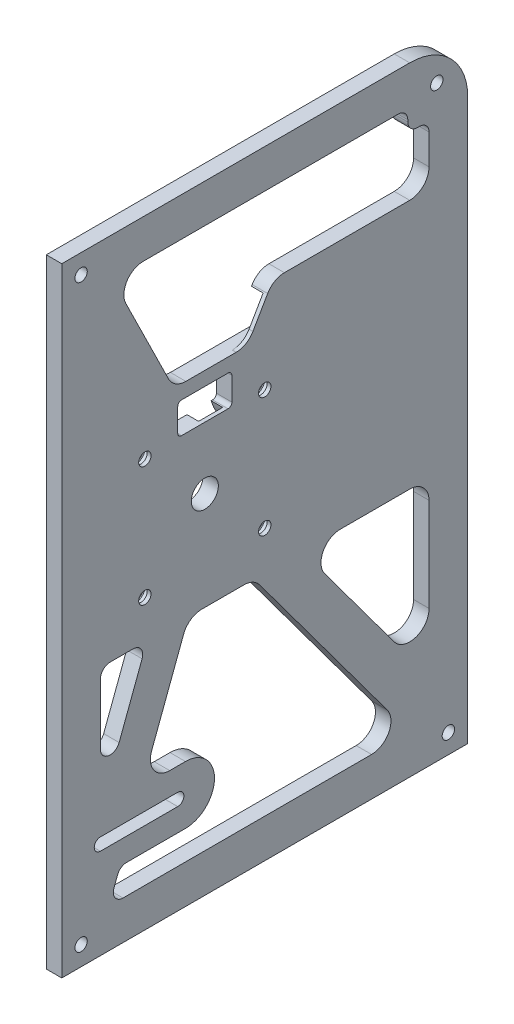
from build123d import *

# Parameters (mm, degrees)
SKETCH2_R               = 1.6
SKETCH2_R_2             = 3.5
SKETCH2_W               = 14
SKETCH2_H               = 8
BOSS_EXTRUDE1_DEPTH     = 4
CHAMFER1_SIZE           = 1.5
FILLET2_R               = 1
CUT_EXTRUDE1_DEPTH      = 3
CUT_EXTRUDE3_DEPTH      = 192.418390062
CUT_EXTRUDE3_DEPTH_BACK = 3
CUT_EXTRUDE4_DEPTH      = 192.418390062
FILLET5_R               = 5
FILLET6_R               = 2.5
SKETCH4_W               = 7.5
SKETCH4_H               = 3
SKETCH4_H_2             = 2.2
BOSS_EXTRUDE2_DEPTH     = 1
CHAMFER2_SIZE           = 1.5
FILLET7_R               = 1.5
SKETCH8_R               = 3.25
CUT_EXTRUDE5_DEPTH      = 3
CHAMFER3_SIZE           = 1


with BuildPart() as part:
    # Sketch2 → Boss-Extrude1 (new body)
    with BuildSketch(Plane(origin=(0, 0, 0), x_dir=(0, 0, -1), z_dir=(1, 0, 0))):
        with BuildLine():
            Line((0, 0), (105, 0))
            Line((105, 0), (105, 145))
            ThreePointArc((105, 145), (100.606601718, 155.606601718), (90, 160))
            Line((90, 160), (0, 160))
            Line((0, 160), (0, 0))
        make_face()
        with Locations((97, 152)):
            Circle(SKETCH2_R, mode=Mode.SUBTRACT)
        with Locations((52.5, 105.5)):
            Circle(SKETCH2_R, mode=Mode.SUBTRACT)
        with Locations((37, 90)):
            Circle(SKETCH2_R_2, mode=Mode.SUBTRACT)
        with Locations((52.5, 74.5)):
            Circle(SKETCH2_R, mode=Mode.SUBTRACT)
        with Locations((21.5, 74.5)):
            Circle(SKETCH2_R, mode=Mode.SUBTRACT)
        with Locations((21.5, 105.5)):
            Circle(SKETCH2_R, mode=Mode.SUBTRACT)
        with Locations((5, 5)):
            Circle(SKETCH2_R, mode=Mode.SUBTRACT)
        with Locations((100, 5)):
            Circle(SKETCH2_R, mode=Mode.SUBTRACT)
        with Locations((5, 155)):
            Circle(SKETCH2_R, mode=Mode.SUBTRACT)
        with BuildLine():
            Line((10, 26.6), (30, 26.6))
            ThreePointArc((30, 26.6), (31.6, 25), (30, 23.4))
            Line((30, 23.4), (10, 23.4))
            ThreePointArc((10, 23.4), (8.4, 25), (10, 26.6))
        make_face(mode=Mode.SUBTRACT)
        with Locations((37, 110)):
            Rectangle(SKETCH2_W, SKETCH2_H, mode=Mode.SUBTRACT)
    extrude(amount=BOSS_EXTRUDE1_DEPTH)

    # Chamfer1
    chamfer1_edges = [part.edges().sort_by_distance(p)[0] for p in [
        (0, 105.5, -50.9),
        (0, 155, -3.4),
        (0, 152, -95.4),
        (0, 74.5, -50.9),
        (0, 74.5, -19.9),
        (0, 105.5, -19.9),
        (0, 5, -98.4),
        (0, 5, -3.4),
    ]]
    chamfer(chamfer1_edges, length=CHAMFER1_SIZE)

    # Fillet2
    fillet2_edges = [part.edges().sort_by_distance(p)[0] for p in [
        (2, 114, -44),
        (2, 106, -44),
        (2, 106, -30),
        (2, 114, -30),
    ]]
    fillet(fillet2_edges, radius=FILLET2_R)

    # Sketch3 → Cut-Extrude1 (cut)
    with BuildSketch(Plane.ZY):
        with BuildLine():
            Line((-105, 92.5), (-52.5, 92.5))
            add(Edge.make_bspline(
                [(-52.5, 92.5), (-52.017876095, 92.5), (-51.044765961, 92.531493431), (-49.175773552, 92.725196799), (-46.936261469, 93.222205465), (-44.452218621, 94.253508486), (-42.224067956, 95.723473893), (-40.309183564, 97.599654696), (-38.734147015, 99.826553944), (-37.697483824, 101.940270927), (-37.02420701, 103.764588585), (-36.733100446, 104.736673195), (-36.602852161, 105.221196817)],
                knots=[0, 0, 0, 0, 0.0625, 0.125, 0.25, 0.375, 0.5, 0.625, 0.75, 0.875, 0.9375, 1, 1, 1, 1], degree=3))
            Line((-36.602852161, 105.221196817), (-36.083650039, 107.15262871))
            Line((-36.083650039, 107.15262871), (-41.877945718, 108.710235075))
            Line((-41.877945718, 108.710235075), (-42.397147839, 106.778803183))
            add(Edge.make_bspline(
                [(-52.5, 98.5), (-52.152707996, 98.5), (-51.440728176, 98.52319383), (-50.160426296, 98.657616892), (-48.727404704, 98.980910008), (-47.274023006, 99.590276287), (-46.021815492, 100.417021541), (-44.916524889, 101.494578792), (-43.931651857, 102.874766669), (-43.215740124, 104.322852557), (-42.722217205, 105.655900021), (-42.496646397, 106.408668549), (-42.397147839, 106.778803183)],
                knots=[0, 0, 0, 0, 0.0625, 0.125, 0.25, 0.375, 0.5, 0.625, 0.75, 0.875, 0.9375, 1, 1, 1, 1], degree=3))
            Line((-52.5, 98.5), (-105, 98.5))
            Line((-105, 98.5), (-105, 92.5))
        make_face()
    extrude(amount=-CUT_EXTRUDE1_DEPTH, mode=Mode.SUBTRACT)

    # Sketch6 → Cut-Extrude3 (cut, two sides: drawn at the far end of the back side and taken through both)
    with BuildSketch(Plane.ZY.offset(-CUT_EXTRUDE3_DEPTH_BACK)):
        Polygon((-440.273054807, 119.8), (-105, 119.8), (-75, 119.8), (-63, 117.6), (-35, 117.6), (-35, 126.4), (-63, 126.4), (-75, 124.2), (-105, 124.2), (-440.273054807, 124.2), (-1110.81916442, 124.2), (-1110.81916442, 119.8), align=None)
    extrude(amount=CUT_EXTRUDE3_DEPTH + CUT_EXTRUDE3_DEPTH_BACK, mode=Mode.SUBTRACT)

    # Sketch7 → Cut-Extrude4 (cut, through all)
    with BuildSketch(Plane.ZY):
        Polygon((-10, 64.5), (-10, 32.472500881), (-22.057411433, 64.5), align=None)
        with BuildLine():
            Line((-32, 17.5), (-15.04847092, 17.5))
            Line((-15.04847092, 17.5), (-12.224941508, 10))
            Line((-12.224941508, 10), (-90.070488158, 10))
            Line((-90.070488158, 10), (-49.676370511, 64.5))
            Line((-49.676370511, 64.5), (-32.742588567, 64.5))
            Line((-32.742588567, 64.5), (-20.695529743, 32.5))
            Line((-20.695529743, 32.5), (-32, 32.5))
            ThreePointArc((-32, 32.5), (-39.5, 25), (-32, 17.5))
        make_face()
        Polygon((-89.5, 150), (-13.034614057, 150), (-28.985383288, 117.6), (-48, 117.6), (-54.697263123, 129.2), (-95, 129.2), (-95, 144.5), (-89.5, 144.5), align=None)
        Polygon((-95, 64.5), (-95, 20.142992167), (-62.123629489, 64.5), align=None)
    extrude(amount=-CUT_EXTRUDE4_DEPTH, mode=Mode.SUBTRACT)

    # Fillet5
    fillet5_edges = [part.edges().sort_by_distance(p)[0] for p in [
        (2, 32.5, -20.695529743),
        (2, 129.2, -95),
        (2, 150, -13.034614057),
        (2, 117.6, -28.985383288),
        (2, 129.2, -54.697263123),
        (3.5, 117.6, -48),
        (2, 64.5, -49.676370511),
        (2, 10, -90.070488158),
        (2, 20.142992167, -95),
        (2, 64.5, -95),
        (2, 64.5, -62.123629489),
        (2, 64.5, -32.742588567),
    ]]
    fillet(fillet5_edges, radius=FILLET5_R)

    # Fillet6
    fillet6_edges = [part.edges().sort_by_distance(p)[0] for p in [
        (2, 64.5, -10),
        (2, 64.5, -22.057411433),
        (2, 10, -12.224941508),
        (2, 17.5, -15.04847092),
        (2, 32.472500881, -10),
        (2, 150, -89.5),
        (2, 144.5, -89.5),
        (2, 144.5, -95),
    ]]
    fillet(fillet6_edges, radius=FILLET6_R)

    # Sketch4 → Boss-Extrude2 (add)
    with BuildSketch(Plane.ZY):
        with Locations((-79.25, 97)):
            Rectangle(SKETCH4_W, SKETCH4_H)
        with Locations((-81.25, 123.1)):
            Rectangle(SKETCH4_W, SKETCH4_H_2)
        with Locations((-101.25, 94)):
            Rectangle(SKETCH4_W, SKETCH4_H)
        with Locations((-57.25, 94)):
            Rectangle(SKETCH4_W, SKETCH4_H)
        with Locations((-101.25, 120.9)):
            Rectangle(SKETCH4_W, SKETCH4_H_2)
    extrude(amount=-BOSS_EXTRUDE2_DEPTH)

    # Chamfer2
    chamfer2_edges = [part.edges().sort_by_distance(p)[0] for p in [
        (1, 124.2, -81.25),
        (1, 119.8, -101.25),
        (1, 92.5, -57.25),
        (1, 92.5, -101.25),
        (1, 98.5, -79.25),
    ]]
    chamfer(chamfer2_edges, length=CHAMFER2_SIZE)

    # Fillet7
    fillet7_edges = [part.edges().sort_by_distance(p)[0] for p in [
        (0.5, 122, -85),
        (0.5, 122, -97.5),
        (0.5, 122, -77.5),
        (0.5, 95.5, -53.5),
        (0.5, 95.5, -61),
        (0.5, 95.5, -75.5),
        (0.5, 95.5, -83),
        (0.5, 95.5, -97.5),
    ]]
    fillet(fillet7_edges, radius=FILLET7_R)

    # Sketch8 → Cut-Extrude5 (cut)
    with BuildSketch(Plane.ZY):
        with Locations((-52.5, 105.5)):
            Circle(SKETCH8_R)
        with Locations((-21.5, 105.5)):
            Circle(SKETCH8_R)
        with Locations((-21.5, 74.5)):
            Circle(SKETCH8_R)
        with Locations((-52.5, 74.5)):
            Circle(SKETCH8_R)
    extrude(amount=-CUT_EXTRUDE5_DEPTH, mode=Mode.SUBTRACT)

    # Chamfer3
    chamfer3_edges = [part.edges().sort_by_distance(p)[0] for p in [
        (0, 74.5, -24.75),
        (0, 74.5, -55.75),
        (0, 105.5, -24.75),
        (0, 105.5, -55.75),
    ]]
    chamfer(chamfer3_edges, length=CHAMFER3_SIZE)


solid = part.part
